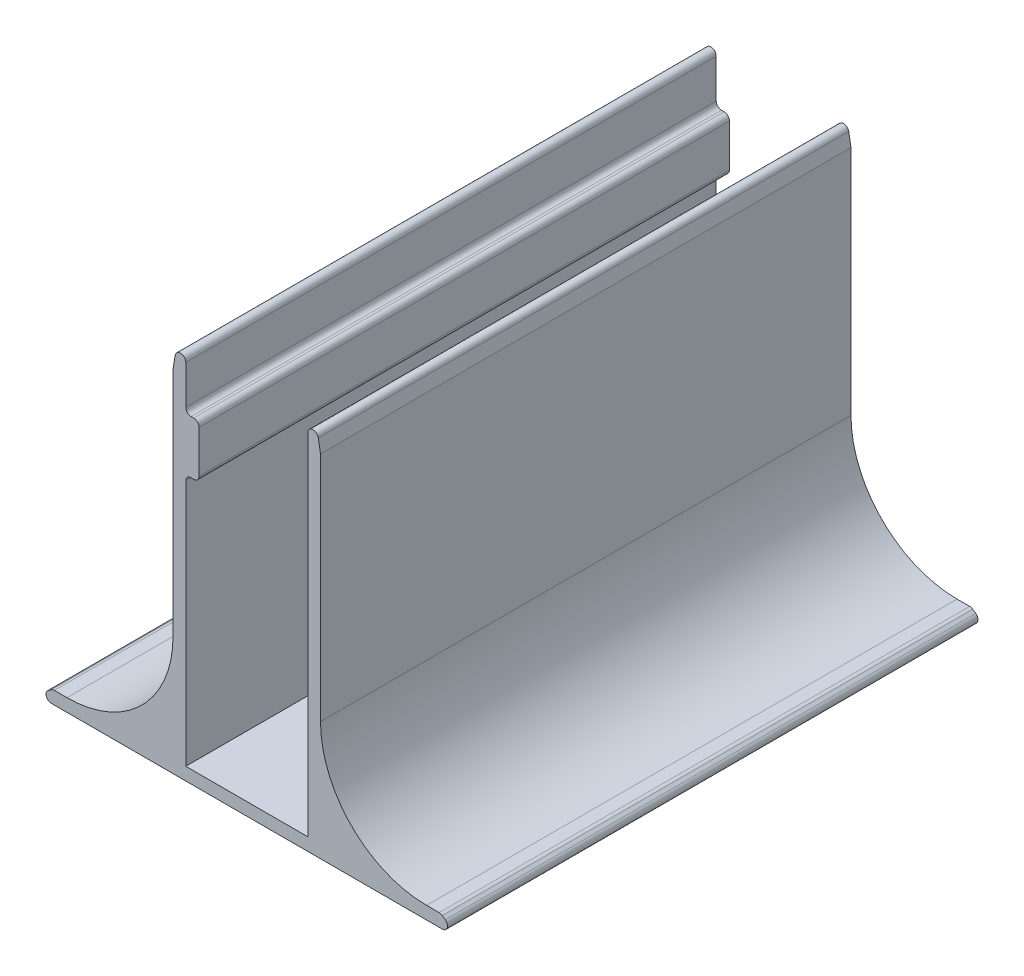
from build123d import *

# Parameters (mm, degrees)
BOSS_EXTRU_1_DEPTH = 100
CONG_2_R           = 1
CONGES_BASE_R      = 20
CONG_4_R           = 1


with BuildPart() as part:
    # Esquisse1 → Boss.-Extru.1 (new body)
    with BuildSketch(Plane.XY):
        Polygon((-11.5, 2.4), (11.5, 2.4), (11.5, 80), (13.9, 66.111581736), (13.9, 2.4), (36.597250994, 2.4), (40, 0), (-40, 0), (-36.597250994, 2.4), (-13.9, 2.4), (-13.9, 66.111581736), (-11.5, 80), (-11.5, 60), (-9, 60), (-9, 50), (-11.5, 50), align=None)
    extrude(amount=BOSS_EXTRU_1_DEPTH)

    # Congé2
    cong_2_edges = [part.edges().sort_by_distance(p)[0] for p in [
        (-11.5, 60, 50),
        (-9, 60, 50),
        (-9, 50, 50),
        (-11.5, 50, 50),
    ]]
    fillet(cong_2_edges, radius=CONG_2_R)

    # Conges_base
    conges_base_edges = [part.edges().sort_by_distance(p)[0] for p in [
        (13.9, 2.4, 50),
        (-13.9, 2.4, 50),
    ]]
    fillet(conges_base_edges, radius=CONGES_BASE_R)

    # Congé4
    cong_4_edges = [part.edges().sort_by_distance(p)[0] for p in [
        (11.5, 80, 50),
        (-11.5, 80, 50),
        (40, 0, 50),
        (-40, 0, 50),
        (-36.597250994, 2.4, 50),
        (36.597250994, 2.4, 50),
    ]]
    fillet(cong_4_edges, radius=CONG_4_R)


solid = part.part
